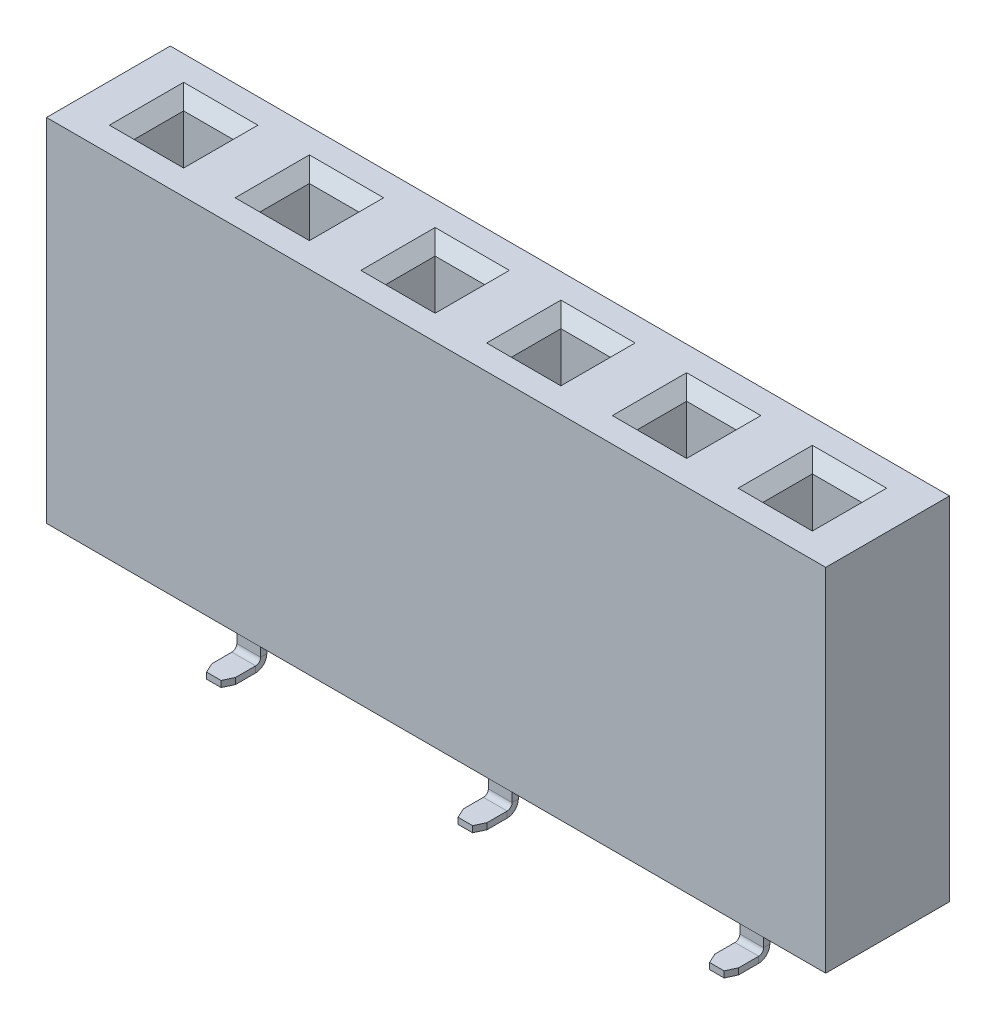
from build123d import *
from OCP.BRepFilletAPI import BRepFilletAPI_MakeChamfer

# Parameters (mm, degrees)
SKETCH1_W                  = 15.74
SKETCH1_H                  = 7.1
BOSS_EXTRUDE1_DEPTH        = 2.5
SKETCH2_W                  = 1
SKETCH2_H                  = 1
CUT_EXTRUDE1_DEPTH         = 2.5
CHAMFER1_SIZE              = 0.25
LPATTERN6_COUNT            = 6
LPATTERN6_PITCH            = 2.54
CHAMFER1_OF_LPATTERN6_SIZE = 0.25
BASE_FLANGE2_DEPTH         = 0.24
BASE_FLANGE2_DEPTH_BACK    = 0.24
BASE_FLANGE3_DEPTH         = 0.24
BASE_FLANGE3_DEPTH_BACK    = 0.24
CHAMFER3_SIZE              = 0.2
CHAMFER3_SIZE2             = 0.093261532
CHAMFER4_SIZE              = 0.2
CHAMFER4_SIZE2             = 0.093261532
LPATTERN4_COUNT            = 3
LPATTERN4_PITCH            = 5.08
LPATTERN3_COUNT            = 3
LPATTERN3_PITCH            = 5.08


# Sheet-metal steps are written as plain solids
with BuildPart() as part:
    # Sketch1 → Boss-Extrude1 (new body)
    with BuildSketch(Plane.XY):
        Rectangle(SKETCH1_W, SKETCH1_H)
    extrude(amount=BOSS_EXTRUDE1_DEPTH)

    # Sketch2 → Cut-Extrude1 (cut)
    with BuildSketch(Plane(origin=(0, 3.55, 0), x_dir=(1, 0, 0), z_dir=(0, 1, 0))):
        with Locations((-6.35, -1.25)):
            Rectangle(SKETCH2_W, SKETCH2_H)
    cut_extrude1 = extrude(amount=-CUT_EXTRUDE1_DEPTH, mode=Mode.SUBTRACT)

    # Chamfer1
    chamfer1_edges = [part.edges().sort_by_distance(p)[0] for p in [
        (-5.85, 3.55, 1.25),
        (-6.35, 3.55, 0.75),
        (-6.85, 3.55, 1.25),
        (-6.35, 3.55, 1.75),
    ]]
    chamfer(chamfer1_edges, length=CHAMFER1_SIZE)

    # LPattern6: Cut-Extrude1 ×6
    with Locations(*[(i * LPATTERN6_PITCH, 0, 0) for i in range(1, LPATTERN6_COUNT)]):
        add(cut_extrude1, mode=Mode.SUBTRACT)

    # Chamfer1 of LPattern6
    chamfer1_of_lpattern6_edges = [part.edges().sort_by_distance(p)[0] for p in [
        (-3.31, 3.55, 1.25),
        (-3.81, 3.55, 0.75),
        (-4.31, 3.55, 1.25),
        (-3.81, 3.55, 1.75),
        (-0.77, 3.55, 1.25),
        (-1.27, 3.55, 0.75),
        (-1.77, 3.55, 1.25),
        (-1.27, 3.55, 1.75),
        (1.77, 3.55, 1.25),
        (1.27, 3.55, 0.75),
        (0.77, 3.55, 1.25),
        (1.27, 3.55, 1.75),
        (4.31, 3.55, 1.25),
        (3.81, 3.55, 0.75),
        (3.31, 3.55, 1.25),
        (3.81, 3.55, 1.75),
        (6.85, 3.55, 1.25),
        (6.35, 3.55, 0.75),
        (5.85, 3.55, 1.25),
        (6.35, 3.55, 1.75),
    ]]
    chamfer(chamfer1_of_lpattern6_edges, length=CHAMFER1_OF_LPATTERN6_SIZE)


with BuildPart() as body_2:
    # Sketch5 → Base-Flange2 (new, two sides: drawn at the far end of the back side and taken through both)
    with BuildSketch(Plane.ZY.offset(6.35).offset(-BASE_FLANGE2_DEPTH_BACK)):
        with BuildLine():
            Line((0.15, -3.55), (0.15, -3.755))
            ThreePointArc((0.15, -3.755), (0.084099026, -3.914099026), (-0.075, -3.98))
            Line((-0.075, -3.98), (-0.68, -3.98))
            Line((-0.68, -3.98), (-0.68, -3.855))
            Line((-0.68, -3.855), (-0.075, -3.855))
            ThreePointArc((-0.075, -3.855), (-0.004289322, -3.825710678), (0.025, -3.755))
            Line((0.025, -3.755), (0.025, -3.55))
            Line((0.025, -3.55), (0.15, -3.55))
        make_face()
    extrude(amount=BASE_FLANGE2_DEPTH + BASE_FLANGE2_DEPTH_BACK)

    # Chamfer4: one chamfer whose edges measure the first distance from different faces: ONE call of the kernel's chamfer builder (chamfer() names one face for all edges)
    chamfer4_edges_1 = [body_2.edges().sort_by_distance(p)[0] for p in [
        (-6.11, -3.9175, -0.68),
    ]]
    chamfer4_side_1 = [body_2.faces().sort_by_distance(p)[0] for p in [
        (-6.11, -3.6525, 0.034347727),
    ]]
    chamfer4_edges_2 = [body_2.edges().sort_by_distance(p)[0] for p in [
        (-6.59, -3.9175, -0.68),
    ]]
    chamfer4_side_2 = [body_2.faces().sort_by_distance(p)[0] for p in [
        (-6.59, -3.6525, 0.034347727),
    ]]
    chamfer4 = BRepFilletAPI_MakeChamfer(body_2.part.solid().wrapped)
    for e in chamfer4_edges_1:
        chamfer4.Add(CHAMFER4_SIZE, CHAMFER4_SIZE2, e.wrapped, chamfer4_side_1[0].wrapped)  # the first distance lies on this face
    for e in chamfer4_edges_2:
        chamfer4.Add(CHAMFER4_SIZE, CHAMFER4_SIZE2, e.wrapped, chamfer4_side_2[0].wrapped)  # the first distance lies on this face
    add(Compound.cast(chamfer4.Shape()), mode=Mode.REPLACE)


with BuildPart() as body_3:
    # Sketch22 → Base-Flange3 (new, two sides: drawn at the far end of the back side and taken through both)
    with BuildSketch(Plane.ZY.offset(3.81).offset(-BASE_FLANGE3_DEPTH_BACK)):
        with BuildLine():
            Line((2.35, -3.55), (2.35, -3.755))
            ThreePointArc((2.35, -3.755), (2.415900974, -3.914099026), (2.575, -3.98))
            Line((2.575, -3.98), (3.18, -3.98))
            Line((3.18, -3.98), (3.18, -3.855))
            Line((3.18, -3.855), (2.575, -3.855))
            ThreePointArc((2.575, -3.855), (2.504289322, -3.825710678), (2.475, -3.755))
            Line((2.475, -3.755), (2.475, -3.55))
            Line((2.475, -3.55), (2.35, -3.55))
        make_face()
    extrude(amount=BASE_FLANGE3_DEPTH + BASE_FLANGE3_DEPTH_BACK)

    # Chamfer3: one chamfer whose edges measure the first distance from different faces: ONE call of the kernel's chamfer builder (chamfer() names one face for all edges)
    chamfer3_edges_1 = [body_3.edges().sort_by_distance(p)[0] for p in [
        (-3.57, -3.9175, 3.18),
    ]]
    chamfer3_side_1 = [body_3.faces().sort_by_distance(p)[0] for p in [
        (-3.57, -3.6525, 2.465652273),
    ]]
    chamfer3_edges_2 = [body_3.edges().sort_by_distance(p)[0] for p in [
        (-4.05, -3.9175, 3.18),
    ]]
    chamfer3_side_2 = [body_3.faces().sort_by_distance(p)[0] for p in [
        (-4.05, -3.6525, 2.465652273),
    ]]
    chamfer3 = BRepFilletAPI_MakeChamfer(body_3.part.solid().wrapped)
    for e in chamfer3_edges_1:
        chamfer3.Add(CHAMFER3_SIZE, CHAMFER3_SIZE2, e.wrapped, chamfer3_side_1[0].wrapped)  # the first distance lies on this face
    for e in chamfer3_edges_2:
        chamfer3.Add(CHAMFER3_SIZE, CHAMFER3_SIZE2, e.wrapped, chamfer3_side_2[0].wrapped)  # the first distance lies on this face
    add(Compound.cast(chamfer3.Shape()), mode=Mode.REPLACE)


with BuildPart() as lpattern4_1:
    # LPattern4: pattern copy
    add(body_2.part.moved(Location(Vector(1, 0, 0) * (1 * LPATTERN4_PITCH))))


with BuildPart() as lpattern4_2:
    # LPattern4: pattern copy
    add(body_2.part.moved(Location(Vector(1, 0, 0) * (2 * LPATTERN4_PITCH))))


with BuildPart() as lpattern3_1:
    # LPattern3: pattern copy
    add(body_3.part.moved(Location(Vector(1, 0, 0) * (1 * LPATTERN3_PITCH))))


with BuildPart() as lpattern3_2:
    # LPattern3: pattern copy
    add(body_3.part.moved(Location(Vector(1, 0, 0) * (2 * LPATTERN3_PITCH))))


solid = Compound([part.part, body_2.part, body_3.part, lpattern4_1.part, lpattern4_2.part, lpattern3_1.part, lpattern3_2.part])
